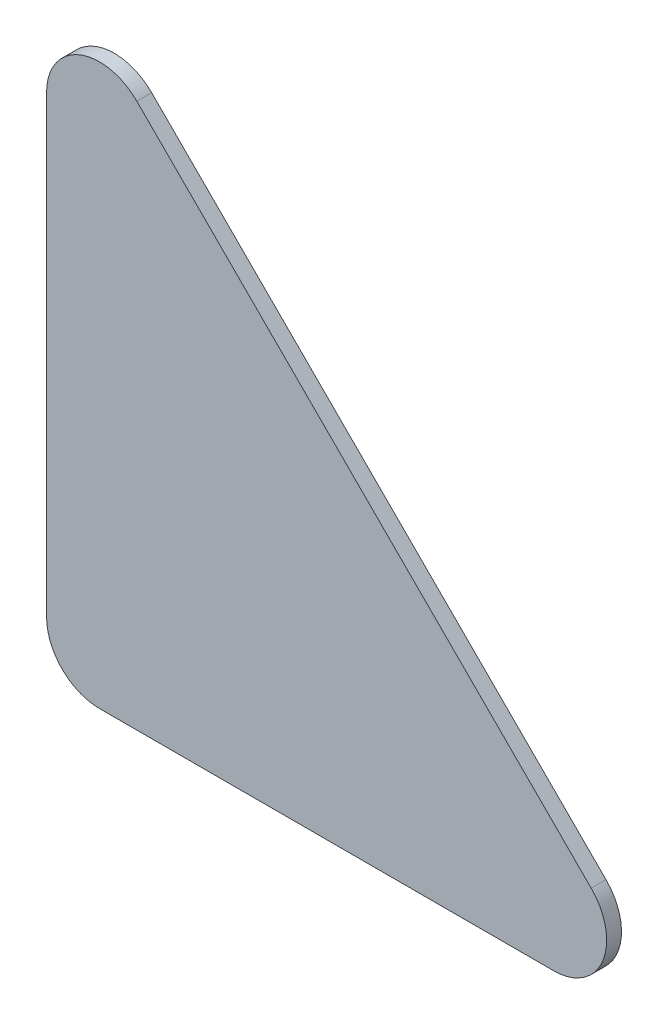
from build123d import *

# Parameters (mm, degrees)
BASE_FLANGE1_DEPTH  = 0.7
BREAK_CORNER1_START = -0.7
BREAK_CORNER1_DEPTH = 0.7


# Read off the part's stored shape, not the designer's step: Break-Corner1
# Sheet-metal steps are written as plain solids
with BuildPart() as part:
    # Sketch1 → Base-Flange1 (new body)
    with BuildSketch(Plane.XY):
        Polygon((0, 0), (0, 30), (30, 0), align=None)
    extrude(amount=-BASE_FLANGE1_DEPTH)

    # Break-Corner1 outline → Break-Corner1 (cut)
    with BuildSketch(Plane.XY.offset(BREAK_CORNER1_START)):
        with BuildLine():
            ThreePointArc((2.499, 0), (0.731940154, 0.731940154), (0, 2.499))
            Line((0, 2.499), (0, 0))
            Line((0, 0), (2.499, 0))
        make_face()
        with BuildLine():
            Line((0, 30), (0, 23.966880308))
            ThreePointArc((0, 23.966880308), (1.542674103, 26.275655259), (4.266059846, 25.733940154))
            Line((4.266059846, 25.733940154), (0, 30))
        make_face()
        with BuildLine():
            ThreePointArc((25.733940154, 4.266059846), (26.275655259, 1.542674103), (23.966880308, 0))
            Line((23.966880308, 0), (30, 0))
            Line((30, 0), (25.733940154, 4.266059846))
        make_face()
    extrude(amount=BREAK_CORNER1_DEPTH, mode=Mode.SUBTRACT)


solid = part.part
